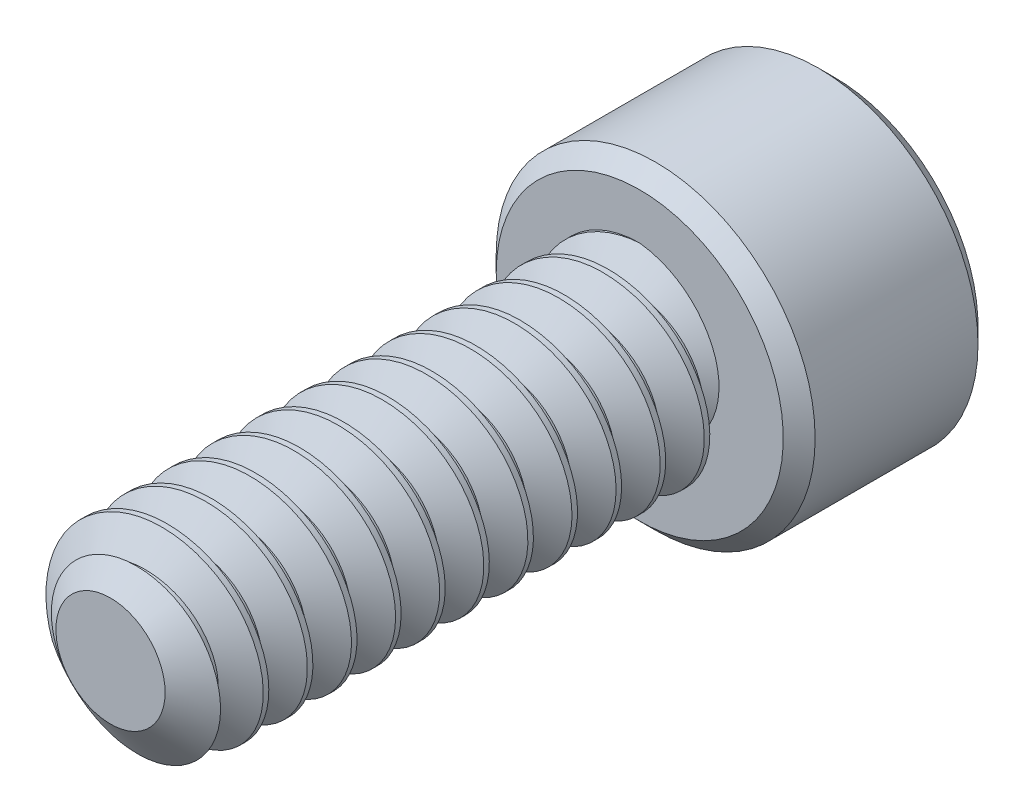
from build123d import *

# Parameters (mm, degrees)
SKETCH1_R          = 1.7526
EXTRUDE1_DEPTH     = 9.525
CUT_SWEEP1_PITCH   = 0.79375
SKETCH6_R          = 2.8702
EXTRUDE2_DEPTH     = 3.5052
CUT_EXTRUDE1_DEPTH = 2.08359375
CHAMFER1_SIZE      = 0.28702


with BuildPart() as part:
    # Sketch1 → Extrude1 (new body)
    with BuildSketch(Plane.XY):
        Circle(SKETCH1_R)
    extrude(amount=-EXTRUDE1_DEPTH)

    # Cut-Sweep1: the profile of Sketch3 profile screwed along a right-hand helix of 13 turns, 6 arcs to a turn; built about Z, then put on its axis
    cut_sweep1_z = Axis((0, 0, 0), (0, 0, 1))
    cut_sweep1_corners = [(1.7529, 0, -0.694704455), (1.237044252, 0, -0.396875), (1.237044252, 0, -0.29765625), (1.7529, 0, 0.000173205)]
    with BuildLine(mode=Mode.PRIVATE) as cut_sweep1_profile:
        Line(cut_sweep1_corners[0], cut_sweep1_corners[1])
        Line(cut_sweep1_corners[1], cut_sweep1_corners[2])
        Line(cut_sweep1_corners[2], cut_sweep1_corners[3])
        Line(cut_sweep1_corners[3], cut_sweep1_corners[0])
    cut_sweep1_cap = Face(cut_sweep1_profile.wire())
    cut_sweep1_turn_angles = [0, 30, 60, 90, 120, 150, 180, 210, 240, 270, 300, 330, 360]
    cut_sweep1_turn_weights = [1, 0.8660254037844387, 1, 0.8660254037844387, 1, 0.8660254037844387, 1, 0.8660254037844387, 1, 0.8660254037844387, 1, 0.8660254037844387, 1]
    cut_sweep1_turn_rails = [Edge.make_bspline([Vector(p[0], p[1], 0).rotate(cut_sweep1_z, cut_sweep1_turn_angles[k]) / cut_sweep1_turn_weights[k] + Vector(0, 0, p[2] + CUT_SWEEP1_PITCH * cut_sweep1_turn_angles[k] / 360) for k in range(13)], [0, 0, 0, 1, 1, 2, 2, 3, 3, 4, 4, 5, 5, 6, 6, 6], 2, cut_sweep1_turn_weights) for p in cut_sweep1_corners]
    cut_sweep1_turn_sides = [Face.make_surface_from_curves(cut_sweep1_turn_rails[p[0]], cut_sweep1_turn_rails[p[1]]) for p in [(0, 1), (1, 2), (2, 3), (3, 0)]]
    cut_sweep1 = Plane(origin=(0, 0, 0), x_dir=(0, 1, 0), z_dir=(0, 0, -1)) * Solid(Shell([*[p.moved(Location((0, 0, CUT_SWEEP1_PITCH * i))) for i in range(13) for p in cut_sweep1_turn_sides], cut_sweep1_cap, cut_sweep1_cap.rotate(cut_sweep1_z, 4680).moved(Location((0, 0, CUT_SWEEP1_PITCH * 4680 / 360)))]))
    add(cut_sweep1, mode=Mode.SUBTRACT)

    # Sketch4 → Cut-Revolve1 (revolve, cut)
    with BuildSketch(Plane(origin=(0, 0, 0), x_dir=(0, 0, -1), z_dir=(1, 0, 0)), mode=Mode.PRIVATE) as cut_revolve1_sk:
        Polygon((0.538848736, 1.7526), (0, 0.983044252), (0, 1.7526), align=None)
    revolve(cut_revolve1_sk.sketch.rotate(Axis((0, 0, 0), (0, 0, -1)), 261.048315518), axis=Axis((0, 0, 0), (0, 0, -1)), mode=Mode.SUBTRACT)

    # Sketch6 → Extrude2 (add)
    with BuildSketch(Plane(origin=(0, 0, -9.525), x_dir=(-1, 0, 0), z_dir=(0, 0, -1))):
        Circle(SKETCH6_R)
    extrude(amount=EXTRUDE2_DEPTH)

    # Sketch7 → Cut-Extrude1 (cut)
    with BuildSketch(Plane(origin=(0, 0, -13.0302), x_dir=(-1, 0, 0), z_dir=(0, 0, -1))):
        Polygon((0, 1.603951217), (-1.3890625, 0.801975608), (-1.3890625, -0.801975608), (0, -1.603951217), (1.3890625, -0.801975608), (1.3890625, 0.801975608), align=None)
    extrude(amount=-CUT_EXTRUDE1_DEPTH, mode=Mode.SUBTRACT)

    # Cut-Extrude2 cone 1 section (through the dimple's axis) → Cut-Extrude2 (revolve, cut)
    with BuildSketch(Plane(origin=(0, 0, -13.0302), x_dir=(0, 1, 0), z_dir=(1, 0, 0))):
        Polygon((0, 0), (1.603951217, 0), (0, 1.603951217), align=None)
    revolve(axis=Axis((0, 0, -13.0302), (0, 0, 1)), mode=Mode.SUBTRACT)

    # Chamfer1
    chamfer1_edges = [part.edges().sort_by_distance(p)[0] for p in [
        (2.8702, 0, -9.525),
        (2.8702, 0, -13.0302),
    ]]
    chamfer(chamfer1_edges, length=CHAMFER1_SIZE)


solid = part.part
